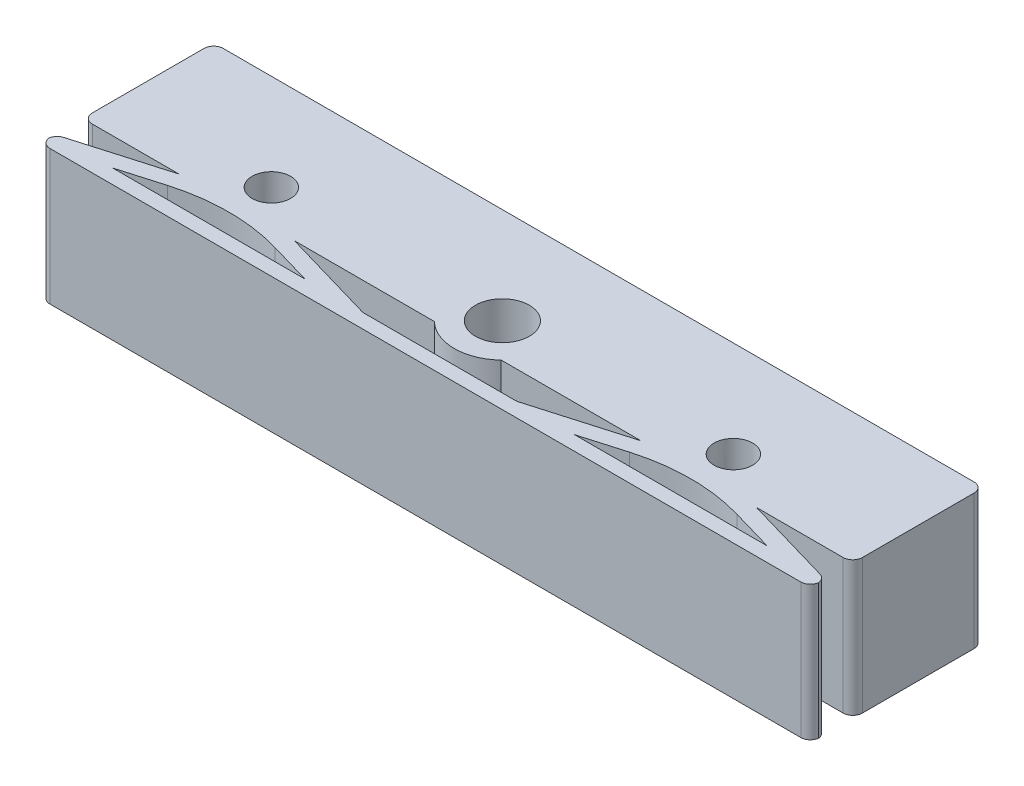
from build123d import *

# Parameters (mm, degrees)
SKETCH1_W               = 40
SKETCH1_H               = 9
BOSS_EXTRUDE1_DEPTH     = 7
CUT_EXTRUDE1_DEPTH      = 5
CUT_EXTRUDE1_DEPTH_BACK = 10
SKETCH2_R               = 1
SKETCH2_R_2             = 1.4
FILLET1_R               = 10
FILLET2_R               = 0.5
SKETCH3_R               = 1.75
CUT_EXTRUDE6_DEPTH      = 3.8
SKETCH4_W               = 3.5
SKETCH4_H               = 0.5
CUT_EXTRUDE7_DEPTH      = 2.5


with BuildPart() as part:
    # Sketch1 → Boss-Extrude1 (new body)
    with BuildSketch(Plane(origin=(0, 0, 0), x_dir=(1, 0, 0), z_dir=(0, 1, 0))):
        with Locations((20, 4.5)):
            Rectangle(SKETCH1_W, SKETCH1_H)
    extrude(amount=BOSS_EXTRUDE1_DEPTH)

    # Sketch2 → Cut-Extrude1 (cut, two sides: drawn at the far end of the back side and taken through both)
    with BuildSketch(Plane(origin=(0, 7, 0), x_dir=(1, 0, 0), z_dir=(0, 1, 0)).offset(-CUT_EXTRUDE1_DEPTH_BACK)):
        with Locations(Location((8, 4, 0), (0, 0, 90))):
            Circle(SKETCH2_R)
        with Locations(Location((32, 4, 0), (0, 0, 90))):
            Circle(SKETCH2_R)
        with Locations(Location((20, 4, 0), (0, 0, 90))):
            Circle(SKETCH2_R_2)
        with BuildLine():
            ThreePointArc((21.734935157, 2.2), (20, 1.5), (18.265064843, 2.2))
            Line((18.265064843, 2.2), (11, 2.2))
            Line((11, 2.2), (16, 0.75))
            Line((16, 0.75), (24, 0.75))
            Line((24, 0.75), (29, 2.2))
            Line((29, 2.2), (21.734935157, 2.2))
        make_face()
        Polygon((13, 0.75), (8, 2.2), (3, 0.75), align=None)
        Polygon((37, 0.75), (32, 2.2), (27, 0.75), align=None)
        Polygon((0, 0.75), (5, 2.2), (0, 2.2), align=None)
        Polygon((40, 2.2), (35, 2.2), (40, 0.75), align=None)
    extrude(amount=CUT_EXTRUDE1_DEPTH + CUT_EXTRUDE1_DEPTH_BACK, mode=Mode.SUBTRACT)

    # Fillet1
    fillet1_edges = [part.edges().sort_by_distance(p)[0] for p in [
        (32, 3.5, -2.2),
        (8, 3.5, -2.2),
    ]]
    fillet(fillet1_edges, radius=FILLET1_R)

    # Fillet2
    # the kernel refuses this fillet: 0.5 mm, written as the material it adds along each edge
    with BuildSketch(Plane(origin=(24, 7, -0.75), x_dir=(0.9604291387787307, 0, -0.27852445024583705), z_dir=(0, -1, 0))) as fillet2_piece_1:
        with BuildLine():
            CenterArc((FILLET2_R * 0.142073204655, -FILLET2_R), FILLET2_R, 90, 16.172159016)
            Line((-FILLET2_R * 0.136451245591, -FILLET2_R * 0.0395708612213), (0, 0))
            Line((0, 0), (FILLET2_R * 0.142073204655, 0))
        make_face()
    extrude(amount=7)
    with BuildSketch(Plane(origin=(16, 0, -0.75), x_dir=(1, 0, 0), z_dir=(0, 1, 0))) as fillet2_piece_2:
        with BuildLine():
            CenterArc((FILLET2_R * 0.142073204655, FILLET2_R), FILLET2_R, 253.827840984, 16.172159016)
            Line((-FILLET2_R * 0.136451245591, FILLET2_R * 0.0395708612213), (0, 0))
            Line((0, 0), (FILLET2_R * 0.142073204655, 0))
        make_face()
    extrude(amount=7)
    # the kernel refuses this fillet: 0.5 mm, written as the material it takes off along each edge
    with BuildSketch(Plane(origin=(0, 7.939001537, -0.75), x_dir=(0.960429138778732, 0, -0.2785244502458324), z_dir=(0, -1, 0)), Plane(origin=(40, 7.939001537, -0.75), x_dir=(0, 0, 1), z_dir=(0, -1, 0))) as fillet2_2_piece_1:
        with BuildLine():
            CenterArc((FILLET2_R * 0.75120122935, FILLET2_R), FILLET2_R, 196.172159016, 73.827840984)
            Line((-FILLET2_R * 0.209227909429, FILLET2_R * 0.721475549754), (0, 0))
            Line((0, 0), (FILLET2_R * 0.75120122935, 0))
        make_face()
    extrude(amount=8.878003073, mode=Mode.SUBTRACT)
    with BuildSketch(Plane(origin=(0, 8.25, -2.2), x_dir=(0, 0, -1), z_dir=(0, -1, 0)), Plane(origin=(40, 8.25, -2.2), x_dir=(-1, 0, 0), z_dir=(0, -1, 0)), Plane(origin=(0, -1.25, 0), x_dir=(1, 0, 0), z_dir=(0, 1, 0))) as fillet2_2_piece_2:
        with BuildLine():
            CenterArc((FILLET2_R, FILLET2_R), FILLET2_R, 180, 90)
            Line((0, FILLET2_R), (0, 0))
            Line((0, 0), (FILLET2_R, 0))
        make_face()
    extrude(amount=9.5, mode=Mode.SUBTRACT)
    with BuildSketch(Plane(origin=(0, -1.25, -9), x_dir=(1, 0, 0), z_dir=(0, 1, 0)), Plane(origin=(40, -1.25, -9), x_dir=(0, 0, 1), z_dir=(0, 1, 0)), Plane(origin=(40, -1.25, 0), x_dir=(-1, 0, 0), z_dir=(0, 1, 0))) as fillet2_2_piece_3:
        with BuildLine():
            CenterArc((FILLET2_R, -FILLET2_R), FILLET2_R, 90, 90)
            Line((0, -FILLET2_R), (0, 0))
            Line((0, 0), (FILLET2_R, 0))
        make_face()
    extrude(amount=9.5, mode=Mode.SUBTRACT)

    # Sketch3 → Cut-Extrude6 (cut)
    with BuildSketch(Plane(origin=(0, 0, -9), x_dir=(-1, 0, 0), z_dir=(0, 0, -1))):
        with Locations((-32, 3.5)):
            Circle(SKETCH3_R)
        with Locations((-8, 3.5)):
            Circle(SKETCH3_R)
    extrude(amount=-CUT_EXTRUDE6_DEPTH, mode=Mode.SUBTRACT)

    # Sketch4 → Cut-Extrude7 (cut)
    with BuildSketch(Plane(origin=(0, 0, -5.2), x_dir=(-1, 0, 0), z_dir=(0, 0, -1))):
        with Locations((-32, 3.5)):
            Rectangle(SKETCH4_W, SKETCH4_H)
        with Locations((-8, 3.5)):
            Rectangle(SKETCH4_W, SKETCH4_H)
    extrude(amount=-CUT_EXTRUDE7_DEPTH, mode=Mode.SUBTRACT)


solid = part.part
